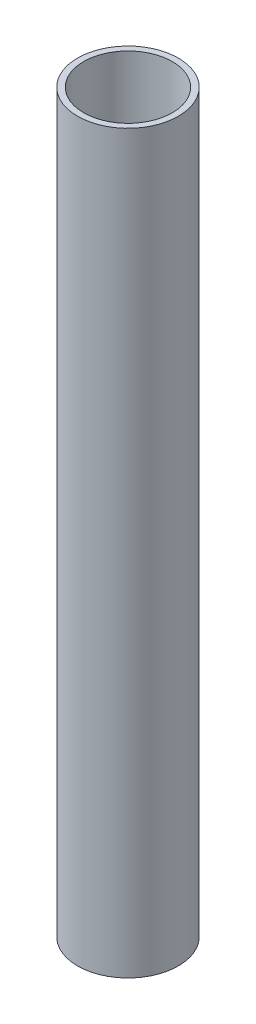
from build123d import *

# Parameters (mm, degrees)
SKETCH1_R           = 1.25
SKETCH1_R_2         = 1.1
BOSS_EXTRUDE1_DEPTH = 18.25


with BuildPart() as part:
    # Sketch1 → Boss-Extrude1 (new body)
    with BuildSketch(Plane(origin=(0, 0, 0), x_dir=(1, 0, 0), z_dir=(0, 1, 0))):
        Circle(SKETCH1_R)
        Circle(SKETCH1_R_2, mode=Mode.SUBTRACT)
    extrude(amount=BOSS_EXTRUDE1_DEPTH)


solid = part.part
